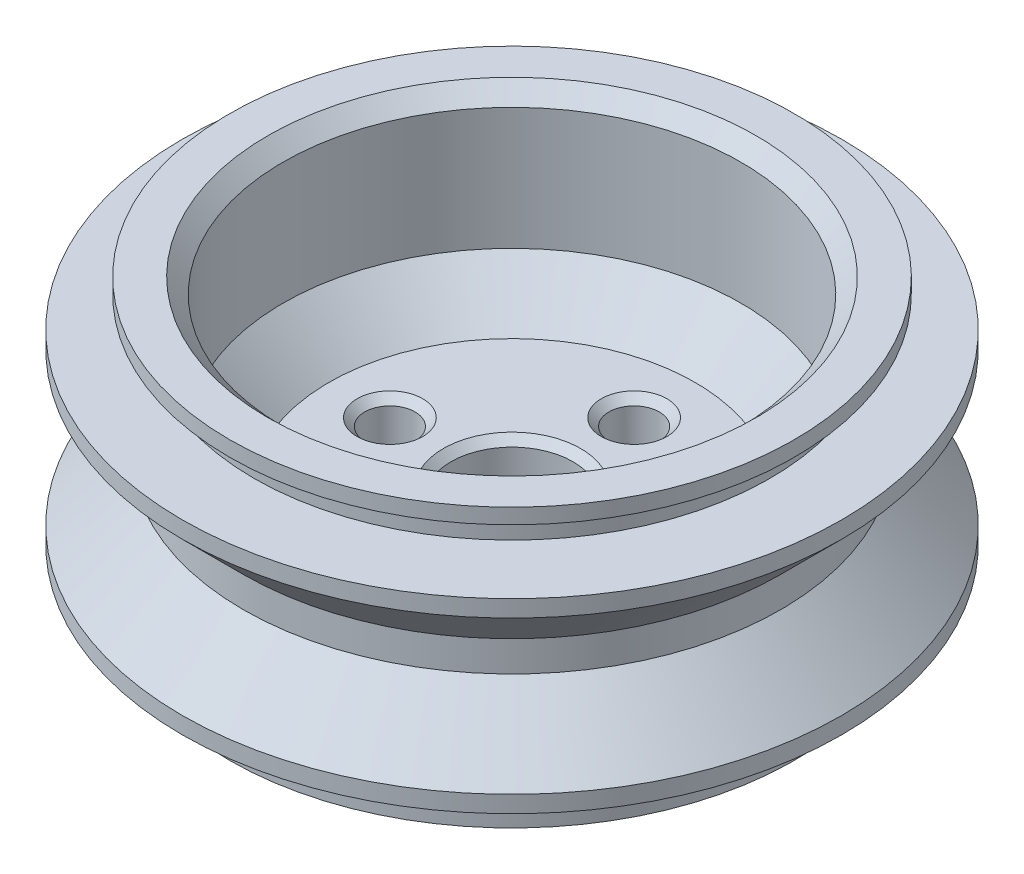
from build123d import *

# Parameters (mm, degrees)
SKETCH_1_R               = 21.6
EXTRUDE_1_DEPTH          = 9.1
SKETCH_2_W               = 4.7
SKETCH_2_H               = 2
SKETCH_2_W_2             = 3.1
SKETCH_2_H_2             = 1
SKETCH_3_R               = 15
CUT_EXTRUDE_1_DEPTH      = 3
SKETCH_4_R               = 4
CUT_EXTRUDE_2_DEPTH      = 20
SKETCH_5_R               = 1.65
CUT_EXTRUDE_3_DEPTH      = 20
PATTERN_CIRCULAR_1_COUNT = 4
CUT_EXTRUDE_START        = -6.2
SKETCH_3_2_R             = 15
CUT_EXTRUDE_4_DEPTH      = 12
SKETCH_6_W               = 4
SKETCH_6_H               = 10
CHAMFER_1_SIZE           = 4
CHAMFER_2_SIZE           = 3
CHAMFER_3_SIZE           = 1
CHAMFER_4_SIZE           = 0.5


with BuildPart() as part:
    # 草图1 → 凸台-拉伸1 (new, symmetric)
    with BuildSketch(Plane(origin=(0, 0, 0), x_dir=(1, 0, 0), z_dir=(0, 1, 0))):
        with Locations(Location((0, 0, 0), (0, 0, 270))):
            Circle(SKETCH_1_R)
    extrude(amount=EXTRUDE_1_DEPTH, both=True)

    # 草图2 → 切除-旋转1 (revolve, cut)
    with BuildSketch(Plane.XY, mode=Mode.PRIVATE) as cut_revolve_1_sk:
        with Locations((19.25, -7.1)):
            Rectangle(SKETCH_2_W, SKETCH_2_H)
        with Locations((20.05, -8.6)):
            Rectangle(SKETCH_2_W_2, SKETCH_2_H_2)
    cut_revolve_1 = revolve(cut_revolve_1_sk.sketch.rotate(Axis((0, 9.1, 0), (0, -1, 0)), 90), axis=Axis((0, 9.1, 0), (0, -1, 0)), mode=Mode.SUBTRACT)

    # 镜向1: 切除-旋转1 across plane
    add(cut_revolve_1.mirror(Plane.ZX), mode=Mode.SUBTRACT)

    # 草图3 → 切除-拉伸1 (cut)
    with BuildSketch(Plane.XZ.offset(9.1)):
        with Locations(Location((0, 0, 0), (0, 0, 270))):
            Circle(SKETCH_3_R)
    extrude(amount=-CUT_EXTRUDE_1_DEPTH, mode=Mode.SUBTRACT)

    # 草图4 → 切除-拉伸2 (cut)
    with BuildSketch(Plane.XZ.offset(6.1)):
        with Locations(Location((0, 0, 0), (0, 0, 270))):
            Circle(SKETCH_4_R)
    extrude(amount=-CUT_EXTRUDE_2_DEPTH, mode=Mode.SUBTRACT)

    # 草图5 → 切除-拉伸3 (cut)
    with BuildSketch(Plane.XZ.offset(6.1)):
        with Locations(Location((-8, 0, 0), (0, 0, 270))):
            Circle(SKETCH_5_R)
    cut_extrude_3 = extrude(amount=-CUT_EXTRUDE_3_DEPTH, mode=Mode.SUBTRACT)

    # 阵列(圆周)1: 切除-拉伸3 ×4 about axis
    pattern_circular_1_axis = Axis((0, 0, 0), (0, 1, 0))
    for i in range(1, PATTERN_CIRCULAR_1_COUNT):
        add(cut_extrude_3.rotate(pattern_circular_1_axis, i * 360 / PATTERN_CIRCULAR_1_COUNT), mode=Mode.SUBTRACT)

    # 草图3<2> → 切除-拉伸4 (cut)
    with BuildSketch(Plane.XZ.offset(9.1).offset(CUT_EXTRUDE_START)):
        with Locations(Location((0, 0, 0), (0, 0, 270))):
            Circle(SKETCH_3_2_R)
    extrude(amount=-CUT_EXTRUDE_4_DEPTH, mode=Mode.SUBTRACT)

    # 草图6 → 切除-旋转2 (revolve, cut)
    with BuildSketch(Plane.XY, mode=Mode.PRIVATE) as cut_revolve_2_sk:
        with Locations((19.6, 0)):
            Rectangle(SKETCH_6_W, SKETCH_6_H)
    revolve(cut_revolve_2_sk.sketch.rotate(Axis((0, 9.1, 0), (0, -1, 0)), 90), axis=Axis((0, 9.1, 0), (0, -1, 0)), mode=Mode.SUBTRACT)

    # 倒角1
    chamfer_1_edges = [part.edges().sort_by_distance(p)[0] for p in [
        (0, -5, -17.6),
        (0, 5, -17.6),
    ]]
    chamfer(chamfer_1_edges, length=CHAMFER_1_SIZE - 0.0001)  # a hair under: the kernel refuses the full size

    # 倒角2
    chamfer_2_edges = [part.edges().sort_by_distance(p)[0] for p in [
        (0, -6.1, 15),
        (0, -2.9, 15),
    ]]
    chamfer(chamfer_2_edges, length=CHAMFER_2_SIZE - 0.0001)  # a hair under: the kernel refuses the full size

    # 倒角3
    chamfer_3_edges = [part.edges().sort_by_distance(p)[0] for p in [
        (0, 9.1, 15),
    ]]
    chamfer(chamfer_3_edges, length=CHAMFER_3_SIZE)

    # 倒角4
    chamfer_4_edges = [part.edges().sort_by_distance(p)[0] for p in [
        (0, -6.1, 4),
        (-8, -6.1, 1.65),
        (-1.65, -6.1, -8),
        (8, -6.1, -1.65),
        (1.65, -6.1, 8),
        (0, -2.9, 4),
        (-8, -2.9, 1.65),
        (1.65, -2.9, 8),
        (8, -2.9, -1.65),
        (-1.65, -2.9, -8),
    ]]
    chamfer(chamfer_4_edges, length=CHAMFER_4_SIZE)


solid = part.part
